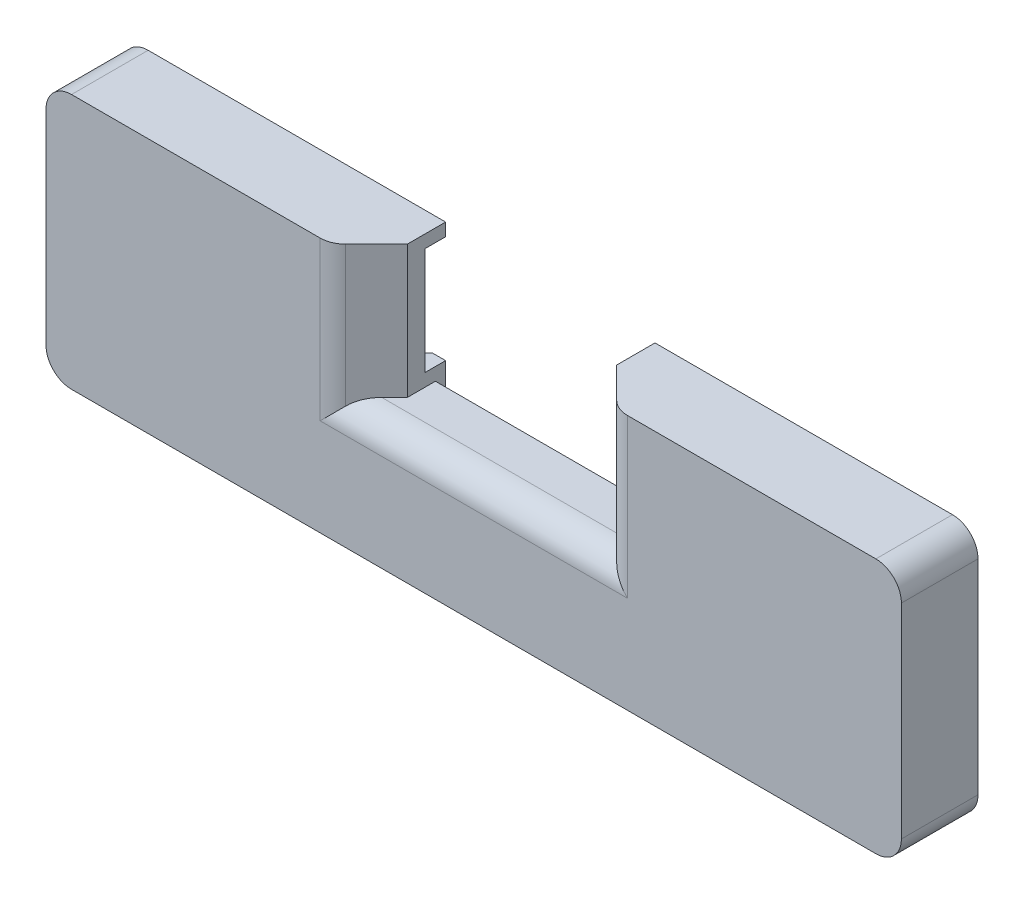
from build123d import *

# Parameters (mm, degrees)
BOSS_EXTRUDE1_DEPTH = 5
BOSS_EXTRUDE2_DEPTH = 25
FILLET1_R           = 10
CHAMFER3_SIZE       = 25
CHAMFER4_SIZE       = 15
SKETCH3_W           = 8
SKETCH3_H           = 42
CUT_EXTRUDE1_DEPTH  = 25
SKETCH4_W           = 8
SKETCH4_H           = 42
CUT_EXTRUDE2_DEPTH  = 25
FILLET2_R           = 10
SKETCH5_W           = 82
SKETCH5_H           = 4
CUT_EXTRUDE3_DEPTH  = 10
CHAMFER5_SIZE       = 10
CHAMFER6_SIZE       = 10


with BuildPart() as part:
    # Sketch1 → Boss-Extrude1 (new body)
    with BuildSketch(Plane.XY):
        Polygon((-167.5, -50), (167.5, -50), (167.5, 50), (41, 50), (41, -2), (-41, -2), (-41, 50), (-167.5, 50), align=None)
    extrude(amount=-BOSS_EXTRUDE1_DEPTH)

    # Sketch2 → Boss-Extrude2 (add)
    with BuildSketch(Plane(origin=(0, 0, -5), x_dir=(-1, 0, 0), z_dir=(0, 0, -1))):
        Polygon((-167.5, 50), (-162.5, 50), (-41, 50), (-41, 45), (-41, -2), (41, -2), (41, 45), (41, 50), (162.5, 50), (167.5, 50), (167.5, -50), (162.5, -50), (-162.5, -50), (-167.5, -50), align=None)
        Polygon((-162.5, 45), (-162.5, -45), (162.5, -45), (162.5, 45), (46, 45), (46, -7), (41, -7), (-41, -7), (-46, -7), (-46, 45), align=None, mode=Mode.SUBTRACT)
    extrude(amount=BOSS_EXTRUDE2_DEPTH)

    # Fillet1
    fillet1_edges = [part.edges().sort_by_distance(p)[0] for p in [
        (167.5, 50, -15),
        (167.5, -50, -15),
        (-167.5, -50, -15),
        (-167.5, 50, -15),
    ]]
    fillet(fillet1_edges, radius=FILLET1_R)

    # Chamfer3
    chamfer3_edges = [part.edges().sort_by_distance(p)[0] for p in [
        (-46, 19, -5),
        (46, 19, -5),
    ]]
    chamfer(chamfer3_edges, length=CHAMFER3_SIZE - 0.0001)  # a hair under: the kernel refuses the full size

    # Chamfer4
    chamfer4_edges = [part.edges().sort_by_distance(p)[0] for p in [
        (-41, 24, 0),
        (41, 24, 0),
    ]]
    chamfer(chamfer4_edges, length=CHAMFER4_SIZE)

    # Sketch3 → Cut-Extrude1 (cut)
    with BuildSketch(Plane(origin=(-41, 0, 0), x_dir=(0, 0, -1), z_dir=(1, 0, 0))):
        with Locations((26, 24)):
            Rectangle(SKETCH3_W, SKETCH3_H)
    extrude(amount=-CUT_EXTRUDE1_DEPTH, mode=Mode.SUBTRACT)

    # Sketch4 → Cut-Extrude2 (cut)
    with BuildSketch(Plane.ZY.offset(-41)):
        with Locations((-26, 24)):
            Rectangle(SKETCH4_W, SKETCH4_H)
    extrude(amount=-CUT_EXTRUDE2_DEPTH, mode=Mode.SUBTRACT)

    # Fillet2
    fillet2_edges = [part.edges().sort_by_distance(p)[0] for p in [
        (0, -2, 0),
        (-56, 24, 0),
        (56, 24, 0),
    ]]
    fillet(fillet2_edges, radius=FILLET2_R)

    # Sketch5 → Cut-Extrude3 (cut)
    with BuildSketch(Plane(origin=(0, -2, 0), x_dir=(1, 0, 0), z_dir=(0, 1, 0))):
        with Locations((0, 28)):
            Rectangle(SKETCH5_W, SKETCH5_H)
    extrude(amount=-CUT_EXTRUDE3_DEPTH, mode=Mode.SUBTRACT)

    # Chamfer5
    chamfer5_edges = [part.edges().sort_by_distance(p)[0] for p in [
        (162.5, 45, -17.5),
        (162.5, -45, -17.5),
        (-162.5, -45, -17.5),
        (-162.5, 45, -17.5),
    ]]
    chamfer(chamfer5_edges, length=CHAMFER5_SIZE)

    # Chamfer6
    chamfer6_edges = [part.edges().sort_by_distance(p)[0] for p in [
        (0, -7, -5),
    ]]
    chamfer(chamfer6_edges, length=CHAMFER6_SIZE)


solid = part.part
